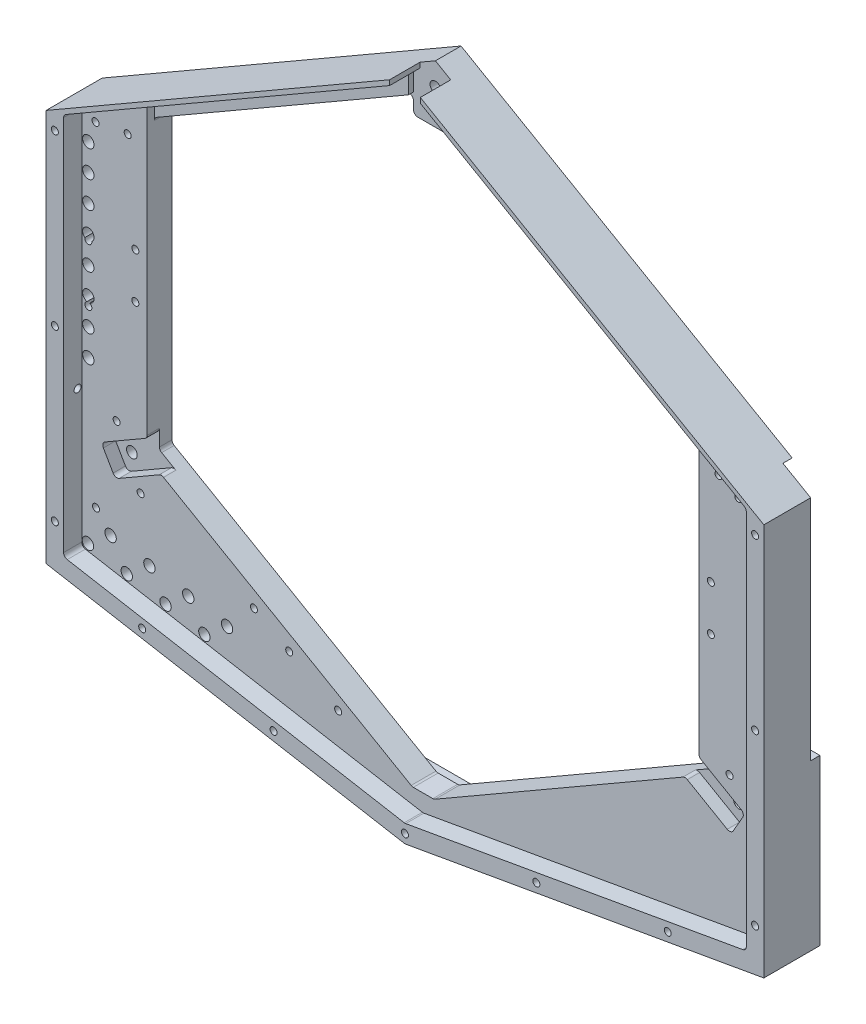
from build123d import *

# Parameters (mm, degrees)
OUTLINE_DEPTH                           = 12.8
INSIDE_CUTOUT_DEPTH                     = 4.14
CUT_FOR_SPRING_BASE_DEPTH               = 114.47095047549391
J_FLEX_MOUNTING_POINT_DEPTH             = 5.85
SPRING_BASE_MOUNTING_CUT_DEPTH          = 3
CENTRAL_COPPER_FLEX_CUTOUT_DEPTH        = 6.95
M2_TAP_DRILL_FOR_BACKPLATE_D            = 1.6
M2_TAP_DRILL_FOR_BACKPLATE_DEPTH        = 3.5
M2_TAP_DRILL_FOR_BACKPLATE_TIP          = 0.48068849522204826
OUTER_COPPER_FLEX_CUTOUTS_DEPTH         = 3
F_2_CLEARANCE_HOLES_FOR_FLEX_FEET_D     = 2.4384
F_2_CLEARANCE_HOLES_FOR_FLEX_FEET_DEPTH = 5.66
CHANNELS_FOR_OUTER_FLEX_DEPTH           = 2.81
SKETCH17_R                              = 0.7999999999999954
OPTIONAL_ALIGNMENT_PINS_DEPTH           = 3
SMA_LINES_REACH                         = 115.471
SKETCH19_R                              = 1.2999999999999945
SKETCH19_R_2                            = 1.2999999999999956
SKETCH19_R_3                            = 1.2999999999999936
SKETCH19_R_4                            = 1.300000000000009
SKETCH19_R_5                            = 1.2999999999999803
SMA_CUTAWAY_DEPTH                       = 2.11
FILLET4_R                               = 3
M2X0_4_TAPPED_FOR_SMAS_D                = 1.6
M2X0_4_TAPPED_FOR_SMAS_DEPTH            = 5
M2X0_4_TAPPED_FOR_SMAS_TIP              = 0.48068849522204826
SLIGHT_RELIEF_UNDER_ARRAY_DEPTH         = 1.66
M2X0_4_TAPPED_FOR_RADIATION_COVER_D     = 1.6
M2X0_4_TAPPED_FOR_RADIATION_COVER_DEPTH = 5
M2X0_4_TAPPED_FOR_RADIATION_COVER_TIP   = 0.48068849522204826
M2X0_4_TAP_FOR_PCB_MOUNTS_D             = 1.6
M2X0_4_TAP_FOR_PCB_MOUNTS_DEPTH         = 4.7
M2X0_4_TAP_FOR_PCB_MOUNTS_TIP           = 0.48068849522204826
TAP_DRILL_FOR_M3X0_5_TAP1_D             = 2.5
TAP_DRILL_FOR_M3X0_5_TAP1_DEPTH         = 6
TAP_DRILL_FOR_M3X0_5_TAP1_TIP           = 0.7510757737844503
M2X0_4_TAP_FOR_THERMOMETER_D            = 1.6
M2X0_4_TAP_FOR_THERMOMETER_DEPTH        = 5
M2X0_4_TAP_FOR_THERMOMETER_TIP          = 0.48068849522204826
FILLET1_R                               = 1
FILLET5_R                               = 1
FILLET6_R                               = 3


with BuildPart() as part:
    # Sketch2 → Outline (new body)
    with BuildSketch(Plane.XY):
        Polygon((-81.94000000000018, 26.61740330842736), (-5.69e-15, 73.92548436582511), (81.93999999999981, 26.617403308426777), (81.93999999999981, -62.99628283492352), (-2.3854e-13, -77.44451563417489), (-81.94000000000018, -62.99628283492292), align=None)
    extrude(amount=-OUTLINE_DEPTH)

    # Sketch3 → Inside Cutout (cut)
    with BuildSketch(Plane.XY):
        Polygon((-77.94000000000018, 27.772103846806722), (-4.5471e-13, 72.77078382744601), (77.93999999999984, 27.77210384680643), (77.93999999999983, -59.63988431021399), (-2.2204e-13, -73.38280918663152), (-77.94000000000018, -59.63988431021344), align=None)
    extrude(amount=-INSIDE_CUTOUT_DEPTH, mode=Mode.SUBTRACT)

    # Sketch5 → Cut for Spring Base (cut, through all)
    with BuildSketch(Plane(origin=(0, 0, -12.8), x_dir=(-1, 0, 0), z_dir=(0, 0, -1))):
        Polygon((9.54e-15, -70.89415224396323), (-63.000000000000306, -34.52108528501766), (-63.000000000000306, 31.778914714982335), (-4.999999999999997, 65.26523032798063), (-5, 69.88403248149764), (4.5471e-13, 72.77078382744601), (5.000000000000001, 69.88403248149814), (5.000000000000001, 65.26523032798113), (62.999999999999694, 31.778914714983017), (62.999999999999694, -34.52108528501698), align=None)
    extrude(amount=-CUT_FOR_SPRING_BASE_DEPTH, mode=Mode.SUBTRACT)

    # Sketch7 → J Flex Mounting Point (add)
    with BuildSketch(Plane(origin=(0, 0, -12.8), x_dir=(-1, 0, 0), z_dir=(0, 0, -1))):
        Polygon((-4.999999999999885, 69.88403248149771), (4.545e-13, 72.77078382744601), (5.000000000000114, 69.88403248149808), (5.000000000000114, 60.77078382744578), (-4.999999999999885, 60.77078382744578), align=None)
    extrude(amount=-J_FLEX_MOUNTING_POINT_DEPTH)

    # Sketch6 → Spring Base Mounting Cut (cut)
    with BuildSketch(Plane(origin=(0, 0, -12.8), x_dir=(-1, 0, 0), z_dir=(0, 0, -1))):
        Polygon((-67.5000000000003, 33.79964065714584), (-67.5000000000003, -37.6965117655606), (-10.000000000001764, -70.89415224396323), (9.54e-15, -70.89415224396323), (9.999999999999995, -70.89415224396323), (67.4999999999997, -37.69651176555993), (67.4999999999997, 33.79964065714669), (6.94e-15, 72.77078382744575), align=None)
    extrude(amount=-SPRING_BASE_MOUNTING_CUT_DEPTH, mode=Mode.SUBTRACT)

    # Sketch9 → Central Copper Flex cutout (cut)
    with BuildSketch(Plane.XY):
        Polygon((3.4999999999995532, 71.90475842366207), (3.4999999999995532, 70.75005788528236), (-4.5471e-13, 72.77078382744601), (-3.5000000000004468, 70.75005788528233), (-3.5000000000004468, 71.90475842366156), (-9.54e-15, 73.92548436582551), align=None)
    extrude(amount=-CENTRAL_COPPER_FLEX_CUTOUT_DEPTH, mode=Mode.SUBTRACT)

    # M2 Tap Drill for Backplate
    with Locations(Plane(origin=(0, 0, -9.799999999999999), x_dir=(-1, 0, 0), z_dir=(0, 0, -1))):
        with Locations((-65, 24.304214177), (-41.13620668, 46.134032481), (-19.485571585, 58.634032481), (19.485571585, 58.634032481), (41.13620668, 46.134032481), (65, 24.324214177), (65, 1.824214177), (65, -20.675785823), (52.009618943, -43.175785823), (32.95706006, -54.175785823), (15.636551984, -64.175785823), (-15.636551984, -64.175785823), (-32.95706006, -54.175785823), (-52.009618943, -43.175785823), (-65, -20.695785823), (-65, 1.804214177)):
            Hole(M2_TAP_DRILL_FOR_BACKPLATE_D / 2, depth=M2_TAP_DRILL_FOR_BACKPLATE_DEPTH)
            with Locations((0, 0, -(M2_TAP_DRILL_FOR_BACKPLATE_DEPTH + M2_TAP_DRILL_FOR_BACKPLATE_TIP / 2))):  # 118° drill point
                Cone(0, M2_TAP_DRILL_FOR_BACKPLATE_D / 2, M2_TAP_DRILL_FOR_BACKPLATE_TIP, mode=Mode.SUBTRACT)

    # Sketch12 → Outer Copper Flex cutouts (cut)
    with BuildSketch(Plane(origin=(0, 0, -12.8), x_dir=(-1, 0, 0), z_dir=(0, 0, -1))):
        Polygon((63.999999999999694, -39.71723770772362), (67.4999999999997, -37.69651176555993), (67.4999999999997, -33.655059881232546), (74.44615242270633, -37.66542285231435), (70.94615242270635, -43.72760067880543), align=None)
        Polygon((-67.5000000000003, -33.65505988123323), (-67.5000000000003, -37.6965117655606), (-64.0000000000003, -39.717237707724294), (-70.94615242270693, -43.72760067880614), (-74.44615242270693, -37.66542285231507), align=None)
    extrude(amount=-OUTER_COPPER_FLEX_CUTOUTS_DEPTH, mode=Mode.SUBTRACT)

    # #2 Clearance Holes for Flex Feet
    with Locations(Plane(origin=(0, 0, -9.799999999999999), x_dir=(-1, 0, 0), z_dir=(0, 0, -1))):
        with Locations((69.303682938, -38.129015634), (-69.308013065, -38.131515634), (0, 68.685484366)):
            Hole(F_2_CLEARANCE_HOLES_FOR_FLEX_FEET_D / 2, depth=F_2_CLEARANCE_HOLES_FOR_FLEX_FEET_DEPTH)

    # Sketch15 → Channels for Outer Flex (cut)
    with BuildSketch(Plane.XY.offset(-4.14)):
        Polygon((-62.999999999999694, -30.794540870306964), (-73.50175914920308, -36.85773434206413), (-70.27447701773319, -42.44755096412918), (-59.77271786852982, -36.38435749237198), (-62.999999999999694, -34.52108528501698), align=None)
        Polygon((63.000000000000306, -34.52108528501766), (63.000000000000306, -30.857546254101788), (73.47880714475102, -36.9074883799115), (70.30608927622175, -42.4027969262845), (59.82728213147089, -36.35285480047483), align=None)
    extrude(amount=-CHANNELS_FOR_OUTER_FLEX_DEPTH, mode=Mode.SUBTRACT)

    # Sketch17 → Optional Alignment Pins (cut)
    with BuildSketch(Plane(origin=(0, 0, -9.799999999999999), x_dir=(-1, 0, 0), z_dir=(0, 0, -1))):
        with Locations((-65.00000000000033, -9.44578582339588)):
            Circle(SKETCH17_R)
        with Locations((64.99999999999972, -9.425785823396222)):
            Circle(SKETCH17_R)
    extrude(amount=-OPTIONAL_ALIGNMENT_PINS_DEPTH, mode=Mode.SUBTRACT)

    # Sketch19 → SMA_Lines (cut, up to next)
    with BuildSketch(Plane(origin=(0, 0, -12.8), x_dir=(-1, 0, 0), z_dir=(0, 0, -1)), mode=Mode.PRIVATE) as sma_lines_sk1:
        with Locations((76.44000000000017, 21.11740330842736)):
            Circle(SKETCH19_R)
    sma_lines_tool1 = extrude(sma_lines_sk1.sketch, amount=-SMA_LINES_REACH, mode=Mode.PRIVATE) & part.part
    # Sketch19 → SMA_Lines (cut, up to next)
    with BuildSketch(Plane(origin=(0, 0, -12.8), x_dir=(-1, 0, 0), z_dir=(0, 0, -1)), mode=Mode.PRIVATE) as sma_lines_sk2:
        with Locations((-76.43999999999981, 22.617403308426777)):
            Circle(SKETCH19_R)
    sma_lines_tool2 = extrude(sma_lines_sk2.sketch, amount=-SMA_LINES_REACH, mode=Mode.PRIVATE) & part.part
    # Sketch19 → SMA_Lines (cut, up to next)
    with BuildSketch(Plane(origin=(0, 0, -12.8), x_dir=(-1, 0, 0), z_dir=(0, 0, -1)), mode=Mode.PRIVATE) as sma_lines_sk3:
        with Locations((-76.4399999999995, 16.517403308426776)):
            Circle(SKETCH19_R_2)
    sma_lines_tool3 = extrude(sma_lines_sk3.sketch, amount=-SMA_LINES_REACH, mode=Mode.PRIVATE) & part.part
    # Sketch19 → SMA_Lines (cut, up to next)
    with BuildSketch(Plane(origin=(0, 0, -12.8), x_dir=(-1, 0, 0), z_dir=(0, 0, -1)), mode=Mode.PRIVATE) as sma_lines_sk4:
        with Locations((-76.43999999999916, 10.41740330842678)):
            Circle(SKETCH19_R)
    sma_lines_tool4 = extrude(sma_lines_sk4.sketch, amount=-SMA_LINES_REACH, mode=Mode.PRIVATE) & part.part
    # Sketch19 → SMA_Lines (cut, up to next)
    with BuildSketch(Plane(origin=(0, 0, -12.8), x_dir=(-1, 0, 0), z_dir=(0, 0, -1)), mode=Mode.PRIVATE) as sma_lines_sk5:
        with Locations((-76.43999999999885, 4.3174033084267815)):
            Circle(SKETCH19_R)
    sma_lines_tool5 = extrude(sma_lines_sk5.sketch, amount=-SMA_LINES_REACH, mode=Mode.PRIVATE) & part.part
    # Sketch19 → SMA_Lines (cut, up to next)
    with BuildSketch(Plane(origin=(0, 0, -12.8), x_dir=(-1, 0, 0), z_dir=(0, 0, -1)), mode=Mode.PRIVATE) as sma_lines_sk6:
        with Locations((-76.43999999999852, -1.7825966915732196)):
            Circle(SKETCH19_R)
    sma_lines_tool6 = extrude(sma_lines_sk6.sketch, amount=-SMA_LINES_REACH, mode=Mode.PRIVATE) & part.part
    # Sketch19 → SMA_Lines (cut, up to next)
    with BuildSketch(Plane(origin=(0, 0, -12.8), x_dir=(-1, 0, 0), z_dir=(0, 0, -1)), mode=Mode.PRIVATE) as sma_lines_sk7:
        with Locations((-76.4399999999982, -7.882596691573221)):
            Circle(SKETCH19_R)
    sma_lines_tool7 = extrude(sma_lines_sk7.sketch, amount=-SMA_LINES_REACH, mode=Mode.PRIVATE) & part.part
    # Sketch19 → SMA_Lines (cut, up to next)
    with BuildSketch(Plane(origin=(0, 0, -12.8), x_dir=(-1, 0, 0), z_dir=(0, 0, -1)), mode=Mode.PRIVATE) as sma_lines_sk8:
        with Locations((-76.43999999999787, -13.982596691573216)):
            Circle(SKETCH19_R)
    sma_lines_tool8 = extrude(sma_lines_sk8.sketch, amount=-SMA_LINES_REACH, mode=Mode.PRIVATE) & part.part
    # Sketch19 → SMA_Lines (cut, up to next)
    with BuildSketch(Plane(origin=(0, 0, -12.8), x_dir=(-1, 0, 0), z_dir=(0, 0, -1)), mode=Mode.PRIVATE) as sma_lines_sk9:
        with Locations((-76.43999999999755, -20.082596691573215)):
            Circle(SKETCH19_R)
    sma_lines_tool9 = extrude(sma_lines_sk9.sketch, amount=-SMA_LINES_REACH, mode=Mode.PRIVATE) & part.part
    # Sketch19 → SMA_Lines (cut, up to next)
    with BuildSketch(Plane(origin=(0, 0, -12.8), x_dir=(-1, 0, 0), z_dir=(0, 0, -1)), mode=Mode.PRIVATE) as sma_lines_sk10:
        with Locations((76.44000000000041, 15.01740330842736)):
            Circle(SKETCH19_R)
    sma_lines_tool10 = extrude(sma_lines_sk10.sketch, amount=-SMA_LINES_REACH, mode=Mode.PRIVATE) & part.part
    # Sketch19 → SMA_Lines (cut, up to next)
    with BuildSketch(Plane(origin=(0, 0, -12.8), x_dir=(-1, 0, 0), z_dir=(0, 0, -1)), mode=Mode.PRIVATE) as sma_lines_sk11:
        with Locations((76.44000000000065, 8.91740330842736)):
            Circle(SKETCH19_R)
    sma_lines_tool11 = extrude(sma_lines_sk11.sketch, amount=-SMA_LINES_REACH, mode=Mode.PRIVATE) & part.part
    # Sketch19 → SMA_Lines (cut, up to next)
    with BuildSketch(Plane(origin=(0, 0, -12.8), x_dir=(-1, 0, 0), z_dir=(0, 0, -1)), mode=Mode.PRIVATE) as sma_lines_sk12:
        with Locations((76.44000000000088, 2.8174033084273633)):
            Circle(SKETCH19_R)
    sma_lines_tool12 = extrude(sma_lines_sk12.sketch, amount=-SMA_LINES_REACH, mode=Mode.PRIVATE) & part.part
    # Sketch19 → SMA_Lines (cut, up to next)
    with BuildSketch(Plane(origin=(0, 0, -12.8), x_dir=(-1, 0, 0), z_dir=(0, 0, -1)), mode=Mode.PRIVATE) as sma_lines_sk13:
        with Locations((76.44000000000112, -3.282596691572638)):
            Circle(SKETCH19_R)
    sma_lines_tool13 = extrude(sma_lines_sk13.sketch, amount=-SMA_LINES_REACH, mode=Mode.PRIVATE) & part.part
    # Sketch19 → SMA_Lines (cut, up to next)
    with BuildSketch(Plane(origin=(0, 0, -12.8), x_dir=(-1, 0, 0), z_dir=(0, 0, -1)), mode=Mode.PRIVATE) as sma_lines_sk14:
        with Locations((76.44000000000135, -9.382596691572639)):
            Circle(SKETCH19_R)
    sma_lines_tool14 = extrude(sma_lines_sk14.sketch, amount=-SMA_LINES_REACH, mode=Mode.PRIVATE) & part.part
    # Sketch19 → SMA_Lines (cut, up to next)
    with BuildSketch(Plane(origin=(0, 0, -12.8), x_dir=(-1, 0, 0), z_dir=(0, 0, -1)), mode=Mode.PRIVATE) as sma_lines_sk15:
        with Locations((76.44000000000159, -15.482596691572633)):
            Circle(SKETCH19_R)
    sma_lines_tool15 = extrude(sma_lines_sk15.sketch, amount=-SMA_LINES_REACH, mode=Mode.PRIVATE) & part.part
    # Sketch19 → SMA_Lines (cut, up to next)
    with BuildSketch(Plane(origin=(0, 0, -12.8), x_dir=(-1, 0, 0), z_dir=(0, 0, -1)), mode=Mode.PRIVATE) as sma_lines_sk16:
        with Locations((76.44000000000183, -21.582596691572636)):
            Circle(SKETCH19_R)
    sma_lines_tool16 = extrude(sma_lines_sk16.sketch, amount=-SMA_LINES_REACH, mode=Mode.PRIVATE) & part.part
    # Sketch19 → SMA_Lines (cut, up to next)
    with BuildSketch(Plane(origin=(0, 0, -12.8), x_dir=(-1, 0, 0), z_dir=(0, 0, -1)), mode=Mode.PRIVATE) as sma_lines_sk17:
        with Locations((49.940000000000175, -63.053899852222344)):
            Circle(SKETCH19_R_3)
    sma_lines_tool17 = extrude(sma_lines_sk17.sketch, amount=-SMA_LINES_REACH, mode=Mode.PRIVATE) & part.part
    # Sketch19 → SMA_Lines (cut, up to next)
    with BuildSketch(Plane(origin=(0, 0, -12.8), x_dir=(-1, 0, 0), z_dir=(0, 0, -1)), mode=Mode.PRIVATE) as sma_lines_sk18:
        with Locations((44.76298760688293, -58.8896137571623)):
            Circle(SKETCH19_R_3)
    sma_lines_tool18 = extrude(sma_lines_sk18.sketch, amount=-SMA_LINES_REACH, mode=Mode.PRIVATE) & part.part
    # Sketch19 → SMA_Lines (cut, up to next)
    with BuildSketch(Plane(origin=(0, 0, -12.8), x_dir=(-1, 0, 0), z_dir=(0, 0, -1)), mode=Mode.PRIVATE) as sma_lines_sk19:
        with Locations((53.626257383992794, -57.32678015815989)):
            Circle(SKETCH19_R_3)
    sma_lines_tool19 = extrude(sma_lines_sk19.sketch, amount=-SMA_LINES_REACH, mode=Mode.PRIVATE) & part.part
    # Sketch19 → SMA_Lines (cut, up to next)
    with BuildSketch(Plane(origin=(0, 0, -12.8), x_dir=(-1, 0, 0), z_dir=(0, 0, -1)), mode=Mode.PRIVATE) as sma_lines_sk20:
        with Locations((58.80326977711004, -61.491066253219934)):
            Circle(SKETCH19_R_3)
    sma_lines_tool20 = extrude(sma_lines_sk20.sketch, amount=-SMA_LINES_REACH, mode=Mode.PRIVATE) & part.part
    # Sketch19 → SMA_Lines (cut, up to next)
    with BuildSketch(Plane(origin=(0, 0, -12.8), x_dir=(-1, 0, 0), z_dir=(0, 0, -1)), mode=Mode.PRIVATE) as sma_lines_sk21:
        with Locations((62.489527161102664, -55.76394655915748)):
            Circle(SKETCH19_R_4)
    sma_lines_tool21 = extrude(sma_lines_sk21.sketch, amount=-SMA_LINES_REACH, mode=Mode.PRIVATE) & part.part
    # Sketch19 → SMA_Lines (cut, up to next)
    with BuildSketch(Plane(origin=(0, 0, -12.8), x_dir=(-1, 0, 0), z_dir=(0, 0, -1)), mode=Mode.PRIVATE) as sma_lines_sk22:
        with Locations((67.66653955421991, -59.928232654217524)):
            Circle(SKETCH19_R_5)
    sma_lines_tool22 = extrude(sma_lines_sk22.sketch, amount=-SMA_LINES_REACH, mode=Mode.PRIVATE) & part.part
    # Sketch19 → SMA_Lines (cut, up to next)
    with BuildSketch(Plane(origin=(0, 0, -12.8), x_dir=(-1, 0, 0), z_dir=(0, 0, -1)), mode=Mode.PRIVATE) as sma_lines_sk23:
        with Locations((71.35279693821253, -54.20111296015507)):
            Circle(SKETCH19_R_3)
    sma_lines_tool23 = extrude(sma_lines_sk23.sketch, amount=-SMA_LINES_REACH, mode=Mode.PRIVATE) & part.part
    # Sketch19 → SMA_Lines (cut, up to next)
    with BuildSketch(Plane(origin=(0, 0, -12.8), x_dir=(-1, 0, 0), z_dir=(0, 0, -1)), mode=Mode.PRIVATE) as sma_lines_sk24:
        with Locations((76.52980933132977, -58.365399055215114)):
            Circle(SKETCH19_R_3)
    sma_lines_tool24 = extrude(sma_lines_sk24.sketch, amount=-SMA_LINES_REACH, mode=Mode.PRIVATE) & part.part
    add(sma_lines_tool1.solids().sort_by_distance((-76.44, 21.117403, -12.8))[0], mode=Mode.SUBTRACT)
    add(sma_lines_tool2.solids().sort_by_distance((76.44, 22.617403, -12.8))[0], mode=Mode.SUBTRACT)
    add(sma_lines_tool3.solids().sort_by_distance((76.44, 16.517403, -12.8))[0], mode=Mode.SUBTRACT)
    add(sma_lines_tool4.solids().sort_by_distance((76.44, 10.417403, -12.8))[0], mode=Mode.SUBTRACT)
    add(sma_lines_tool5.solids().sort_by_distance((76.44, 4.317403, -12.8))[0], mode=Mode.SUBTRACT)
    add(sma_lines_tool6.solids().sort_by_distance((76.44, -1.782597, -12.8))[0], mode=Mode.SUBTRACT)
    add(sma_lines_tool7.solids().sort_by_distance((76.44, -7.882597, -12.8))[0], mode=Mode.SUBTRACT)
    add(sma_lines_tool8.solids().sort_by_distance((76.44, -13.982597, -12.8))[0], mode=Mode.SUBTRACT)
    add(sma_lines_tool9.solids().sort_by_distance((76.44, -20.082597, -12.8))[0], mode=Mode.SUBTRACT)
    add(sma_lines_tool10.solids().sort_by_distance((-76.44, 15.017403, -12.8))[0], mode=Mode.SUBTRACT)
    add(sma_lines_tool11.solids().sort_by_distance((-76.44, 8.917403, -12.8))[0], mode=Mode.SUBTRACT)
    add(sma_lines_tool12.solids().sort_by_distance((-76.44, 2.817403, -12.8))[0], mode=Mode.SUBTRACT)
    add(sma_lines_tool13.solids().sort_by_distance((-76.44, -3.282597, -12.8))[0], mode=Mode.SUBTRACT)
    add(sma_lines_tool14.solids().sort_by_distance((-76.44, -9.382597, -12.8))[0], mode=Mode.SUBTRACT)
    add(sma_lines_tool15.solids().sort_by_distance((-76.44, -15.482597, -12.8))[0], mode=Mode.SUBTRACT)
    add(sma_lines_tool16.solids().sort_by_distance((-76.44, -21.582597, -12.8))[0], mode=Mode.SUBTRACT)
    add(sma_lines_tool17.solids().sort_by_distance((-49.94, -63.0539, -12.8))[0], mode=Mode.SUBTRACT)
    add(sma_lines_tool18.solids().sort_by_distance((-44.762988, -58.889614, -12.8))[0], mode=Mode.SUBTRACT)
    add(sma_lines_tool19.solids().sort_by_distance((-53.626257, -57.32678, -12.8))[0], mode=Mode.SUBTRACT)
    add(sma_lines_tool20.solids().sort_by_distance((-58.80327, -61.491066, -12.8))[0], mode=Mode.SUBTRACT)
    add(sma_lines_tool21.solids().sort_by_distance((-62.489527, -55.763947, -12.8))[0], mode=Mode.SUBTRACT)
    add(sma_lines_tool22.solids().sort_by_distance((-67.66654, -59.928233, -12.8))[0], mode=Mode.SUBTRACT)
    add(sma_lines_tool23.solids().sort_by_distance((-71.352797, -54.201113, -12.8))[0], mode=Mode.SUBTRACT)
    add(sma_lines_tool24.solids().sort_by_distance((-76.529809, -58.365399, -12.8))[0], mode=Mode.SUBTRACT)

    # Sketch20 → SMA Cutaway (cut)
    with BuildSketch(Plane(origin=(0, 0, -12.8), x_dir=(-1, 0, 0), z_dir=(0, 0, -1))):
        Polygon((67.4999999999997, 23.84466519800491), (73.08124278936407, 29.425907987369293), (81.94000000000017, 20.567150776733197), (81.94000000000018, -62.99628283492253), (42.44000000000018, -69.96119857290746), (42.44000000000018, -58.914909511451675), (37.67686027918577, -58.914909511451675), (37.67686027918577, -54.914909511451675), (42.4400000000002, -52.16490951145166), (63.999999999999694, -39.71723770772362), (67.4999999999997, -33.655059881232546), align=None)
        Polygon((-75.60958527266814, 30.27226995533369), (-67.5000000000003, 22.162684682665844), (-67.5000000000003, -25.38259669157322), (-81.93999999999981, -25.382596691573223), (-81.93999999999981, 26.61740330842717), align=None)
    extrude(amount=-SMA_CUTAWAY_DEPTH, mode=Mode.SUBTRACT)

    # Fillet4
    fillet4_edges = [part.edges().sort_by_distance(p)[0] for p in [
        (-37.67686027918577, -58.914909511451675, -11.745000000000001),
        (-73.08124278936407, 29.425907987369293, -11.745000000000001),
    ]]
    fillet(fillet4_edges, radius=FILLET4_R)

    # M2x0.4 Tapped for SMAs
    with Locations(Plane(origin=(0, 0, -10.689999999999998), x_dir=(-1, 0, 0), z_dir=(0, 0, -1))):
        with Locations((73.895, 23.662403308), (78.985, 18.572403308), (-78.985, 25.162403308), (-73.895, 20.072403308), (-78.985, 19.062403308), (-73.895, 13.972403308), (-78.985, 12.962403308), (-73.895, 7.872403308), (-78.985, 6.862403308), (-73.895, 1.772403308), (-78.985, 0.762403308), (-73.895, -4.327596692), (-78.985, -5.337596692), (-73.895, -10.427596692), (-78.985, -11.437596692), (-73.895, -16.527596692), (-78.985, -17.537596692), (-73.895, -22.627596692), (73.895, 17.562403308), (78.985, 12.472403308), (73.895, 11.462403308), (78.985, 6.372403308), (73.895, 5.362403308), (78.985, 0.272403308), (73.895, -0.737596692), (78.985, -5.827596692), (73.895, -6.837596692), (78.985, -11.927596692), (73.895, -12.937596692), (78.985, -18.027596692), (73.895, -19.037596692), (78.985, -24.127596692), (49.315, -59.508899852), (50.565, -66.598899852), (58.178269777, -57.946066253), (59.428269777, -65.036066253), (67.041539554, -56.383232654), (68.291539554, -63.473232654), (75.904809331, -54.820399055), (77.154809331, -61.910399055), (45.387987607, -62.434613757), (44.137987607, -55.344613757), (54.251257384, -60.871780158), (53.001257384, -53.781780158), (63.114527161, -59.308946559), (61.864527161, -52.218946559), (71.977796938, -57.74611296), (70.727796938, -50.65611296)):
            Hole(M2X0_4_TAPPED_FOR_SMAS_D / 2, depth=M2X0_4_TAPPED_FOR_SMAS_DEPTH)
            with Locations((0, 0, -(M2X0_4_TAPPED_FOR_SMAS_DEPTH + M2X0_4_TAPPED_FOR_SMAS_TIP / 2))):  # 118° drill point
                Cone(0, M2X0_4_TAPPED_FOR_SMAS_D / 2, M2X0_4_TAPPED_FOR_SMAS_TIP, mode=Mode.SUBTRACT)

    # Sketch23 → Slight Relief Under Array (cut)
    with BuildSketch(Plane.XY.offset(-4.14)):
        Polygon((-62.999999999999694, 31.778914714983017), (-62.999999999999694, 36.39771686850003), (-5.000000000000001, 69.88403248149814), (-5.000000000000001, 65.26523032798113), align=None)
        Polygon((4.999999999999999, 65.26523032798063), (4.999999999999999, 69.88403248149764), (63.000000000000306, 36.397716868499174), (63.000000000000306, 31.778914714982335), align=None)
    extrude(amount=-SLIGHT_RELIEF_UNDER_ARRAY_DEPTH, mode=Mode.SUBTRACT)

    # M2x0.4 Tapped for Radiation Cover
    with Locations(Plane.XY):
        with Locations((-79.94, 23.617403308), (-79.94, -53.63988431), (-30, -70.123852989), (30, -70.123852989), (79.94, -53.63988431), (79.94, 23.617403308), (-79.94, -15.011240501), (0, -75.41366241), (79.94, -15.011240501), (-60, -64.834043568), (60, -64.834043568)):
            Hole(M2X0_4_TAPPED_FOR_RADIATION_COVER_D / 2, depth=M2X0_4_TAPPED_FOR_RADIATION_COVER_DEPTH)
            with Locations((0, 0, -(M2X0_4_TAPPED_FOR_RADIATION_COVER_DEPTH + M2X0_4_TAPPED_FOR_RADIATION_COVER_TIP / 2))):  # 118° drill point
                Cone(0, M2X0_4_TAPPED_FOR_RADIATION_COVER_D / 2, M2X0_4_TAPPED_FOR_RADIATION_COVER_TIP, mode=Mode.SUBTRACT)

    # M2x0.4 Tap for PCB Mounts
    with Locations(Plane.XY.offset(-4.14)):
        with Locations((76.44, 12.367403308), (74.69, -12.632596692), (-76.44, 14.617403308), (-76.44, -11.382596692), (-74.69, -50.382596692), (-19.3942, -62.851596692), (-76.44, 1.617403308), (-67.45, 27.111803308), (-65.6984, 5.145603308), (-65.6984, -5.187396692), (-69.9656, -30.882596692), (-64.5046, -42.434796692), (-38.622, -52.234396692), (-30.5702, -56.755596692), (71.966178048, 24.850096108), (74.69, -0.132596692), (69.97, -30.882596692), (67.45, 27.111803308), (65.7, 5.145603308), (65.7, -5.187396692), (-74.788247876, 25.83669509)):
            Hole(M2X0_4_TAP_FOR_PCB_MOUNTS_D / 2, depth=M2X0_4_TAP_FOR_PCB_MOUNTS_DEPTH)
            with Locations((0, 0, -(M2X0_4_TAP_FOR_PCB_MOUNTS_DEPTH + M2X0_4_TAP_FOR_PCB_MOUNTS_TIP / 2))):  # 118° drill point
                Cone(0, M2X0_4_TAP_FOR_PCB_MOUNTS_D / 2, M2X0_4_TAP_FOR_PCB_MOUNTS_TIP, mode=Mode.SUBTRACT)

    # Tap Drill for M3x0.5 Tap1
    with Locations(Plane(origin=(0, 0, -12.8), x_dir=(-1, 0, 0), z_dir=(0, 0, -1))):
        with Locations((-69.353829072, 29.770783827), (69.353829072, 29.770783827), (40, -61.444515634), (-40, -61.444515634)):
            Hole(TAP_DRILL_FOR_M3X0_5_TAP1_D / 2, depth=TAP_DRILL_FOR_M3X0_5_TAP1_DEPTH)
            with Locations((0, 0, -(TAP_DRILL_FOR_M3X0_5_TAP1_DEPTH + TAP_DRILL_FOR_M3X0_5_TAP1_TIP / 2))):  # 118° drill point
                Cone(0, TAP_DRILL_FOR_M3X0_5_TAP1_D / 2, TAP_DRILL_FOR_M3X0_5_TAP1_TIP, mode=Mode.SUBTRACT)

    # M2x0.4 Tap for Thermometer
    with Locations(Plane.ZY.offset(81.94000000000018)):
        with Locations((-3.19, -27.996282835)):
            Hole(M2X0_4_TAP_FOR_THERMOMETER_D / 2, depth=M2X0_4_TAP_FOR_THERMOMETER_DEPTH)
            with Locations((0, 0, -(M2X0_4_TAP_FOR_THERMOMETER_DEPTH + M2X0_4_TAP_FOR_THERMOMETER_TIP / 2))):  # 118° drill point
                Cone(0, M2X0_4_TAP_FOR_THERMOMETER_D / 2, M2X0_4_TAP_FOR_THERMOMETER_TIP, mode=Mode.SUBTRACT)

    # Fillet1
    fillet1_edges = [part.edges().sort_by_distance(p)[0] for p in [
        (-5.000000000000001, 69.88403248149814, -6.375),
        (5, 69.88403248149764, -6.375),
        (-62.999999999999694, 31.778914714983017, -7.800000000000001),
        (63.000000000000306, 31.778914714982335, -7.800000000000001),
        (-62.999999999999694, 36.39771686850003, -4.97),
        (63.000000000000306, 36.397716868499174, -4.97),
        (67.5000000000003, 33.79964065714584, -11.3),
        (-6.94e-15, 72.77078382744575, -11.3),
        (-67.4999999999997, 33.79964065714669, -11.3),
        (-9.999999999999995, -70.89415224396323, -11.3),
        (10.000000000001764, -70.89415224396323, -11.3),
        (-77.94000000000018, -59.63988431021344, -2.07),
        (-77.94000000000018, 27.772103846806722, -2.07),
        (77.93999999999984, 27.77210384680643, -2.07),
        (77.93999999999983, -59.63988431021399, -2.07),
        (-2.2204e-13, -73.38280918663152, -2.07),
        (-70.94615242270635, -43.72760067880543, -10.245000000000001),
        (-63.999999999999694, -39.71723770772362, -10.245000000000001),
        (-67.4999999999997, -33.655059881232546, -10.245000000000001),
        (-74.44615242270633, -37.66542285231435, -10.245000000000001),
        (74.44615242270693, -37.66542285231507, -11.3),
        (67.5000000000003, -33.65505988123323, -11.3),
        (64.0000000000003, -39.717237707724294, -11.3),
        (70.94615242270693, -43.72760067880614, -11.3),
        (-62.999999999999694, -34.52108528501698, -8.375),
        (63.000000000000306, -34.52108528501766, -8.375),
        (-62.999999999999694, -30.794540870306964, -5.545),
        (-59.77271786852982, -36.38435749237198, -5.545),
        (-70.27447701773319, -42.44755096412918, -5.545),
        (-73.50175914920308, -36.85773434206413, -5.545),
        (59.82728213147089, -36.35285480047483, -5.545),
        (63.000000000000306, -30.857546254101788, -5.545),
        (73.47880714475102, -36.9074883799115, -5.545),
        (70.30608927622175, -42.4027969262845, -5.545),
        (-5.000000000000001, 65.26523032798113, -8.375),
        (4.999999999999997, 65.26523032798063, -8.375),
        (4.999999999999885, 60.77078382744578, -8.375),
        (-5.000000000000114, 60.77078382744578, -8.375),
    ]]
    fillet(fillet1_edges, radius=FILLET1_R)

    # Fillet2
    # the kernel refuses this chamfer: 5 mm, written as the material it adds along each edge
    with BuildSketch(Plane(origin=(-9.54e-15, -70.89415224396323, -9.8), x_dir=(0.8818947015264238, 0.47144642900293543, 0), z_dir=(0, 0, 1))) as fillet2_piece_1:
        with BuildLine():
            Line((3.0615900008546393, 3e-17), (-1.7006413873879895, 2.545810716615868))
            Line((-1.7006413873879895, 2.545810716615868), (-1.785564580868314, 2.4930087165675308))
            ThreePointArc((-1.785564580868314, 2.4930087165675308), (-0.8927822904341519, 1.246504358283763), (-0.08492319348032422, -0.05280200004833689))
            Line((-0.08492319348032422, -0.05280200004833689), (0.00326627667231724, -0.09994664294862994))
            ThreePointArc((0.00326627667231724, -0.09994664294862994), (1.5324281387634773, -0.04997332147432252), (3.0648562775269563, -0.09994664294862984))
            Line((3.0648562775269563, -0.09994664294862984), (3.0615900008546393, 3e-17))
        make_face()
    extrude(amount=5.66)

    # Fillet5
    fillet5_edges = [part.edges().sort_by_distance(p)[0] for p in [
        (-2.499999999999483, -69.45077657098946, -6.970000000000001),
        (2.500000000001778, -69.45077657098818, -6.970000000000001),
    ]]
    fillet(fillet5_edges, radius=FILLET5_R)

    # Fillet6
    fillet6_edges = [part.edges().sort_by_distance(p)[0] for p in [
        (-42.44000000000018, -58.914909511451675, -11.745000000000001),
    ]]
    fillet(fillet6_edges, radius=FILLET6_R)


solid = part.part
